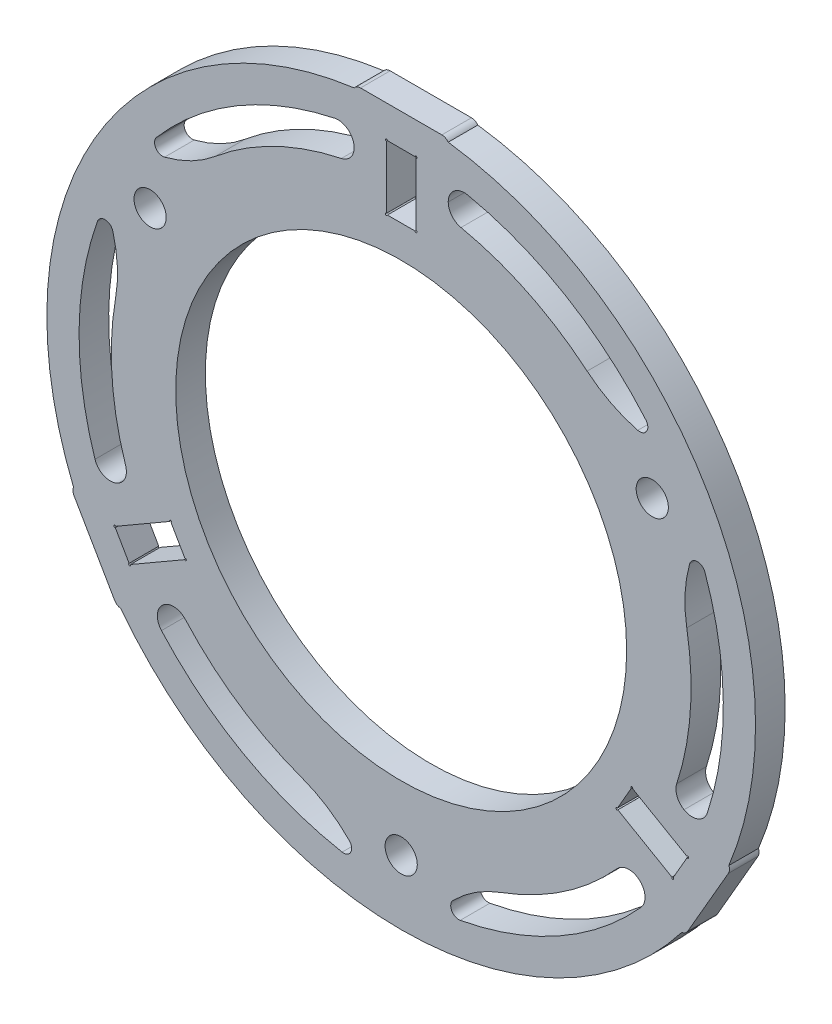
from build123d import *

# Parameters (mm, degrees)
SKETCH1_R           = 44.45
SKETCH1_R_2         = 3.175
BOSS_EXTRUDE1_DEPTH = 5.842
FILLET5_R           = 25.4
SKETCH3_R           = 69.85
SKETCH3_R_2         = 63.5
BOSS_EXTRUDE3_DEPTH = 5.842
FILLET7_R           = 1.5875
SKETCH5_W           = 18.542
SKETCH5_H           = 25.4
BOSS_EXTRUDE4_DEPTH = 5.842
CIRPATTERN1_COUNT   = 3
FILLET8_R           = 1.5875
CUT_EXTRUDE7_DEPTH  = 99.955414168
CIRPATTERN2_COUNT   = 3
FILLET9_R           = 3.175


with BuildPart() as part:
    # Sketch1 → Boss-Extrude1 (new body)
    with BuildSketch(Plane.XY):
        with BuildLine():
            ThreePointArc((-53.551878894, 19.957924914), (-49.493351826, -28.575), (-9.491869465, -56.35625))
            ThreePointArc((-9.491869465, -56.35625), (0, -66.675), (9.491869465, -56.35625))
            ThreePointArc((9.491869465, -56.35625), (49.493351826, -28.575), (53.551878894, 19.957924914))
            ThreePointArc((53.551878894, 19.957924914), (57.742243797, 33.3375), (44.06000943, 36.398325086))
            ThreePointArc((44.06000943, 36.398325086), (0, 57.15), (-44.06000943, 36.398325086))
            ThreePointArc((-44.06000943, 36.398325086), (-57.742243797, 33.3375), (-53.551878894, 19.957924914))
        make_face()
        Circle(SKETCH1_R, mode=Mode.SUBTRACT)
        with Locations((49.493351826, 28.575)):
            Circle(SKETCH1_R_2, mode=Mode.SUBTRACT)
        with Locations((0, -57.15)):
            Circle(SKETCH1_R_2, mode=Mode.SUBTRACT)
        with Locations((-49.493351826, 28.575)):
            Circle(SKETCH1_R_2, mode=Mode.SUBTRACT)
    extrude(amount=BOSS_EXTRUDE1_DEPTH)

    # Fillet5
    fillet5_edges = [part.edges().sort_by_distance(p)[0] for p in [
        (44.06000943, 36.398325086, 2.921),
        (53.551878894, 19.957924914, 2.921),
        (9.491869465, -56.35625, 2.921),
        (-9.491869465, -56.35625, 2.921),
        (-53.551878894, 19.957924914, 2.921),
        (-44.06000943, 36.398325086, 2.921),
    ]]
    fillet(fillet5_edges, radius=FILLET5_R)

    # Sketch3 → Boss-Extrude3 (add)
    with BuildSketch(Plane(origin=(0, 0, 0), x_dir=(-1, 0, 0), z_dir=(0, 0, -1))):
        Circle(SKETCH3_R)
        Circle(SKETCH3_R_2, mode=Mode.SUBTRACT)
    extrude(amount=-BOSS_EXTRUDE3_DEPTH)

    # Fillet7
    fillet7_edges = [part.edges().sort_by_distance(p)[0] for p in [
        (58.345991594, 25.059833697, 2.921),
        (50.875448393, 37.999194081, 2.921),
        (-7.470543201, -63.059027778, 2.921),
        (7.470543201, -63.059027778, 2.921),
        (-50.875448393, 37.999194081, 2.921),
        (-58.345991594, 25.059833697, 2.921),
    ]]
    fillet(fillet7_edges, radius=FILLET7_R)

    # Sketch5 → Boss-Extrude4 (add)
    with BuildSketch(Plane.XY.offset(5.842)):
        with Locations((0, 57.15)):
            Rectangle(SKETCH5_W, SKETCH5_H)
    boss_extrude4 = extrude(amount=-BOSS_EXTRUDE4_DEPTH)

    # CirPattern1: Boss-Extrude4 ×3 about axis
    cirpattern1_axis = Axis((0, 0, 0), (0, 0, 1))
    for i in range(1, CIRPATTERN1_COUNT):
        add(boss_extrude4.rotate(cirpattern1_axis, i * 360 / CIRPATTERN1_COUNT))

    # Fillet8
    # the kernel refuses this fillet: 1.5875 mm, written as the material it takes off along each edge
    with BuildSketch(Plane(origin=(65.127374454, -26.896078482, 8.984658812), x_dir=(-0.8660254037844379, 0.500000000000001, 0), z_dir=(0, 0, -1)), Plane(origin=(-9.271, 69.85, 8.984658812), x_dir=(0, -1, 0), z_dir=(0, 0, -1))) as fillet8_piece_1:
        with BuildLine():
            CenterArc((1.5875, -1.257063525), FILLET8_R, 127.641167987, 52.358832013)
            Line((0, -1.257063525), (-0.03175, -1.257063525))
            Line((-0.03175, -1.257063525), (-0.03175, 0))
            Line((-0.03175, 0), (0, 0.03175))
            ThreePointArc((0, 0.03175), (0.30899554, 0.03175), (0.598600902, 0.02514127))
            Line((0.598600902, 0.02514127), (0.617991081, 0))
        make_face()
    extrude(amount=12.127317624, mode=Mode.SUBTRACT)
    with BuildSketch(Plane(origin=(55.856374454, -42.953921518, 8.984658812), x_dir=(0.5000000000000007, 0.8660254037844382, 0), z_dir=(0, 0, -1)), Plane(origin=(-65.127374454, -26.896078482, 8.984658812), x_dir=(0.5000000000000024, -0.8660254037844373, 0), z_dir=(0, 0, -1)), Plane(origin=(9.271, 69.85, 8.984658812), x_dir=(-1, 0, 0), z_dir=(0, 0, -1))) as fillet8_piece_2:
        with BuildLine():
            CenterArc((1.257063525, -1.5875), FILLET8_R, 90, 52.358832013)
            Line((0, -0.617991081), (-0.02514127, -0.598600902))
            ThreePointArc((-0.02514127, -0.598600902), (-0.03175, -0.30899554), (-0.03175, 0))
            Line((-0.03175, 0), (0, 0.03175))
            Line((0, 0.03175), (1.257063525, 0.03175))
            Line((1.257063525, 0.03175), (1.257063525, 0))
        make_face()
    extrude(amount=12.127317624, mode=Mode.SUBTRACT)
    with BuildSketch(Plane(origin=(-55.856374454, -42.953921518, 8.984658812), x_dir=(-0.5, 0.8660254037844386, 0), z_dir=(0, 0, -1))) as fillet8_piece_3:
        with BuildLine():
            CenterArc((1.257063525, 1.5875), FILLET8_R, 217.641167987, 52.358832013)
            Line((0, 0.617991081), (-0.02514127, 0.598600902))
            ThreePointArc((-0.02514127, 0.598600902), (-0.03175, 0.30899554), (-0.03175, 0))
            Line((-0.03175, 0), (0, -0.03175))
            Line((0, -0.03175), (1.257063525, -0.03175))
            Line((1.257063525, -0.03175), (1.257063525, 0))
        make_face()
    extrude(amount=12.127317624, mode=Mode.SUBTRACT)

    # Sketch7 → Cut-Extrude7 (cut, through all)
    with BuildSketch(Plane.XY.offset(5.842)):
        with BuildLine():
            Line((2.7225625, 63.5), (-2.7225625, 63.5))
            ThreePointArc((-2.7225625, 63.5), (-3.061316502, 63.640316502), (-2.921, 63.3015625))
            Line((-2.921, 63.3015625), (-2.921, 50.9984375))
            ThreePointArc((-2.921, 50.9984375), (-3.061316502, 50.659683498), (-2.7225625, 50.8))
            Line((-2.7225625, 50.8), (2.7225625, 50.8))
            ThreePointArc((2.7225625, 50.8), (3.061316502, 50.659683498), (2.921, 50.9984375))
            Line((2.921, 50.9984375), (2.921, 63.3015625))
            ThreePointArc((2.921, 63.3015625), (3.061316502, 63.640316502), (2.7225625, 63.5))
        make_face()
    cut_extrude7 = extrude(amount=-CUT_EXTRUDE7_DEPTH, mode=Mode.SUBTRACT)

    # CirPattern2: Cut-Extrude7 ×3 about axis
    cirpattern2_axis = Axis((0, 0, 0), (0, 0, 1))
    for i in range(1, CIRPATTERN2_COUNT):
        add(cut_extrude7.rotate(cirpattern2_axis, i * 360 / CIRPATTERN2_COUNT), mode=Mode.SUBTRACT)

    # Fillet9
    # the kernel refuses this fillet: 3.175 mm, written as the material it adds along each edge
    with BuildSketch(Plane(origin=(9.271, 56.393005408, 5.842), x_dir=(0.9828671529049069, -0.18431538118291227, 0), z_dir=(0, 0, -1)), Plane(origin=(44.202275279, -36.225424223, 5.842), x_dir=(-0.6510553788650718, -0.7590302323694741, 0), z_dir=(0, 0, -1)), Plane(origin=(-53.473275279, -20.167581186, 5.842), x_dir=(-0.33181177403983686, 0.9433456135523905, 0), z_dir=(0, 0, -1))) as fillet9_piece_1:
        with BuildLine():
            CenterArc((2.635092544, -3.174201143), FILLET9_R, 91.285314708, 78.093465038)
            Line((-0.485510666, -2.588999807), (0, 0))
            ThreePointArc((0, 0), (1.281936913, -0.014379431), (2.563873827, 0))
        make_face()
    extrude(amount=5.842)
    with BuildSketch(Plane(origin=(9.271, 62.819571465, 5.842), x_dir=(0, -1, 0), z_dir=(0, 0, -1)), Plane(origin=(49.767844743, -39.438707251, 5.842), x_dir=(-0.8660254037844377, 0.5000000000000018, 0), z_dir=(0, 0, -1)), Plane(origin=(-59.038844743, -23.380864214, 5.842), x_dir=(0.8660254037844375, 0.500000000000002, 0), z_dir=(0, 0, -1))) as fillet9_piece_2:
        with BuildLine():
            CenterArc((3.792436103, -3.175), FILLET9_R, 90, 101.906534962)
            ThreePointArc((0.685744768, -3.830052632), (0.313529726, -1.920279918), (0, 0))
            Line((0, 0), (3.792436103, 0))
        make_face()
    extrude(amount=5.842)
    with BuildSketch(Plane(origin=(-9.271, 56.393005408, 5.842), x_dir=(-0.9828671529049081, -0.18431538118290586, 0), z_dir=(0, 0, -1))) as fillet9_piece_3:
        with BuildLine():
            CenterArc((2.635092544, 3.174201143), FILLET9_R, 190.621220255, 78.093465038)
            Line((-0.485510666, 2.588999807), (0, 0))
            ThreePointArc((0, 0), (1.281936913, 0.014379431), (2.563873827, 0))
        make_face()
    extrude(amount=5.842)
    with BuildSketch(Plane(origin=(-9.271, 62.819571465, 5.842), x_dir=(-0.9843471139890508, -0.17624062863433815, 0), z_dir=(0, 0, -1)), Plane(origin=(59.038844743, -23.380864214, 5.842), x_dir=(0.339544695418249, 0.9405899211735838, 0), z_dir=(0, 0, -1)), Plane(origin=(-49.767844743, -39.438707251, 5.842), x_dir=(0.6448024185707977, -0.7643492925392487, 0), z_dir=(0, 0, -1))) as fillet9_piece_4:
        with BuildLine():
            CenterArc((3.79368341, -3.173509537), FILLET9_R, 88.244328147, 101.906534962)
            Line((0.668381323, -3.733073533), (0, 0))
            ThreePointArc((0, 0), (1.945478672, 0.029809259), (3.890957343, 0))
        make_face()
    extrude(amount=5.842)
    with BuildSketch(Plane(origin=(53.473275279, -20.167581186, 5.842), x_dir=(0.8660254037844376, -0.5000000000000019, 0), z_dir=(0, 0, -1)), Plane(origin=(-44.202275279, -36.225424223, 5.842), x_dir=(-0.866025403784439, -0.49999999999999933, 0), z_dir=(0, 0, -1))) as fillet9_piece_5:
        with BuildLine():
            CenterArc((2.634129953, -3.175), FILLET9_R, 90, 78.093465038)
            ThreePointArc((-0.472561382, -2.519947368), (-0.22214762, -1.262624035), (0, 0))
            Line((0, 0), (2.634129953, 0))
        make_face()
    extrude(amount=5.842)


solid = part.part
